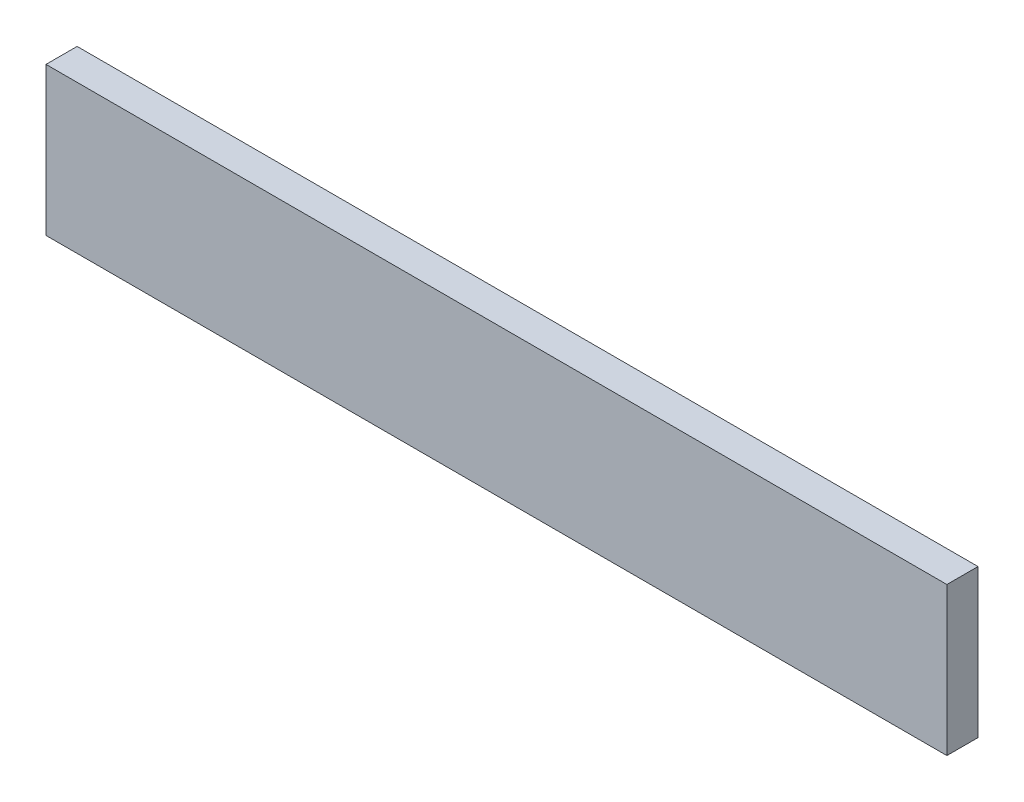
from build123d import *

# Parameters (mm, degrees)
SKETCH1_W           = 154.432
SKETCH1_H           = 25.4
BOSS_EXTRUDE1_DEPTH = 2.667


with BuildPart() as part:
    # Sketch1 → Boss-Extrude1 (new, symmetric)
    with BuildSketch(Plane.XY):
        with Locations((77.216, 12.7)):
            Rectangle(SKETCH1_W, SKETCH1_H)
    extrude(amount=BOSS_EXTRUDE1_DEPTH, both=True)


solid = part.part
